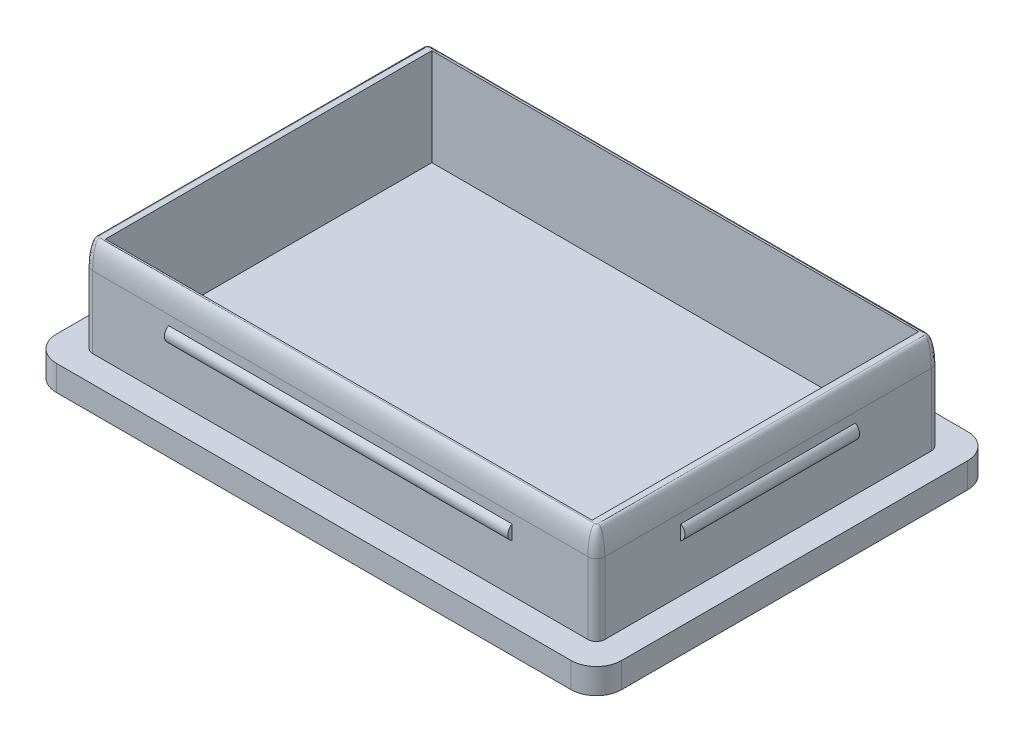
from build123d import *

# Parameters (mm, degrees)
SKETCH1_W           = 61
SKETCH1_H           = 41
BOSS_EXTRUDE1_DEPTH = 23
SHELL1_T            = 3
SKETCH2_W           = 67
SKETCH2_H           = 47
CUT_EXTRUDE1_DEPTH  = 23
SKETCH3_W           = 60.7
SKETCH3_H           = 40.7
SKETCH3_W_2         = 57.7
SKETCH3_H_2         = 38.7
BOSS_EXTRUDE2_DEPTH = 11.5
BOSS_EXTRUDE3_START = -10
SKETCH4_R           = 1
BOSS_EXTRUDE3_DEPTH = 20.7
BOSS_EXTRUDE4_START = -10
BOSS_EXTRUDE4_DEPTH = 40.7
FILLET1_R           = 3
FILLET2_R           = 1
FILLET3_SIZE        = 3
FILLET3_SIZE_2      = 0.8


with BuildPart() as part:
    # Sketch1 → Boss-Extrude1 (new body)
    with BuildSketch(Plane(origin=(0, 0, 0), x_dir=(1, 0, 0), z_dir=(0, 1, 0))):
        Rectangle(SKETCH1_W, SKETCH1_H)
    extrude(amount=BOSS_EXTRUDE1_DEPTH)

    # Shell1
    shell1_openings = [part.faces().sort_by_distance(p)[0] for p in [
        (0, 23, 0),
    ]]
    offset(amount=SHELL1_T, openings=shell1_openings, kind=Kind.INTERSECTION)

    # Sketch2 → Cut-Extrude1 (cut)
    with BuildSketch(Plane(origin=(0, 23, 0), x_dir=(1, 0, 0), z_dir=(0, 1, 0))):
        Rectangle(SKETCH2_W, SKETCH2_H)
    extrude(amount=-CUT_EXTRUDE1_DEPTH, mode=Mode.SUBTRACT)

    # Sketch3 → Boss-Extrude2 (add)
    with BuildSketch(Plane(origin=(0, 0, 0), x_dir=(1, 0, 0), z_dir=(0, 1, 0))):
        Rectangle(SKETCH3_W, SKETCH3_H)
        Rectangle(SKETCH3_W_2, SKETCH3_H_2, mode=Mode.SUBTRACT)
    extrude(amount=BOSS_EXTRUDE2_DEPTH)

    # Sketch4 → Boss-Extrude3 (add)
    with BuildSketch(Plane.XY.offset(20.35).offset(BOSS_EXTRUDE3_START)):
        with Locations((-29.85, 6.5)):
            Circle(SKETCH4_R)
        with Locations((29.85, 6.5)):
            Circle(SKETCH4_R)
    extrude(amount=-BOSS_EXTRUDE3_DEPTH)

    # Sketch5 → Boss-Extrude4 (add)
    with BuildSketch(Plane(origin=(30.35, 0, 0), x_dir=(0, 0, -1), z_dir=(1, 0, 0)).offset(BOSS_EXTRUDE4_START)):
        with BuildLine():
            Line((-20.35, 5.633974596), (-20.35, 7.366025404))
            ThreePointArc((-20.35, 7.366025404), (-20.85, 6.5), (-20.35, 5.633974596))
        make_face()
        with BuildLine():
            ThreePointArc((20.35, 5.633974596), (20.716025404, 6), (20.85, 6.5))
            ThreePointArc((20.85, 6.5), (20.716025404, 7), (20.35, 7.366025404))
            Line((20.35, 7.366025404), (20.35, 5.633974596))
        make_face()
    extrude(amount=-BOSS_EXTRUDE4_DEPTH)

    # Fillet1
    fillet1_edges = [part.edges().sort_by_distance(p)[0] for p in [
        (33.5, -1.5, 23.5),
        (-33.5, -1.5, 23.5),
        (-33.5, -1.5, -23.5),
        (33.5, -1.5, -23.5),
    ]]
    fillet(fillet1_edges, radius=FILLET1_R)

    # Fillet2
    fillet2_edges = [part.edges().sort_by_distance(p)[0] for p in [
        (30.35, 5.75, 20.35),
        (30.35, 5.75, -20.35),
        (-30.35, 5.75, -20.35),
        (-30.35, 5.75, 20.35),
    ]]
    fillet(fillet2_edges, radius=FILLET2_R)

    # Fillet3
    # an asymmetric fillet: 3, 0.8 mm, written as the material it takes off along each edge
    with BuildSketch(Plane(origin=(30.35, 11.5, -19.35), x_dir=(0, -1, 0), z_dir=(0, 0, 1)), Plane(origin=(-30.35, 11.5, 19.35), x_dir=(0, -1, 0), z_dir=(0, 0, -1))) as fillet3_piece_1:
        with BuildLine():
            Bezier((FILLET3_SIZE, 0), (0, 0), (0, -FILLET3_SIZE_2), weights=[1, 0.707106781, 1])
            Line((0, -FILLET3_SIZE_2), (0, 0))
            Line((0, 0), (FILLET3_SIZE, 0))
        make_face()
    extrude(amount=38.7, mode=Mode.SUBTRACT)
    with BuildSketch(Plane(origin=(29.35, 11.5, -19.35), x_dir=(0, 0, -1), z_dir=(-1, 0, 0))) as fillet3_piece_2:
        with BuildLine():
            Bezier((1, FILLET3_SIZE), (1, 0), (1 - FILLET3_SIZE_2, 0), weights=[1, 0.707106781, 1])
            Line((1 - FILLET3_SIZE_2, 0), (1, 0))
            Line((1, 0), (1, FILLET3_SIZE))
        make_face()
    revolve(axis=Axis((29.35, 11.5, -19.35), (0, -1, 0)), revolution_arc=90, mode=Mode.SUBTRACT)
    with BuildSketch(Plane(origin=(29.35, 11.5, 19.35), x_dir=(1, 0, 0), z_dir=(0, 0, -1))) as fillet3_piece_3:
        with BuildLine():
            Bezier((1, FILLET3_SIZE), (1, 0), (1 - FILLET3_SIZE_2, 0), weights=[1, 0.707106781, 1])
            Line((1 - FILLET3_SIZE_2, 0), (1, 0))
            Line((1, 0), (1, FILLET3_SIZE))
        make_face()
    revolve(axis=Axis((29.35, 11.5, 19.35), (0, -1, 0)), revolution_arc=90, mode=Mode.SUBTRACT)
    with BuildSketch(Plane(origin=(-29.35, 11.5, -20.35), x_dir=(0, -1, 0), z_dir=(1, 0, 0)), Plane(origin=(29.35, 11.5, 20.35), x_dir=(0, -1, 0), z_dir=(-1, 0, 0))) as fillet3_piece_4:
        with BuildLine():
            Bezier((FILLET3_SIZE, 0), (0, 0), (0, -FILLET3_SIZE_2), weights=[1, 0.707106781, 1])
            Line((0, -FILLET3_SIZE_2), (0, 0))
            Line((0, 0), (FILLET3_SIZE, 0))
        make_face()
    extrude(amount=58.7, mode=Mode.SUBTRACT)
    with BuildSketch(Plane(origin=(-29.35, 11.5, -19.35), x_dir=(0, 0, -1), z_dir=(1, 0, 0))) as fillet3_piece_5:
        with BuildLine():
            Bezier((1, -FILLET3_SIZE), (1, 0), (1 - FILLET3_SIZE_2, 0), weights=[1, 0.707106781, 1])
            Line((1 - FILLET3_SIZE_2, 0), (1, 0))
            Line((1, 0), (1, -FILLET3_SIZE))
        make_face()
    revolve(axis=Axis((-29.35, 11.5, -19.35), (0, 1, 0)), revolution_arc=90, mode=Mode.SUBTRACT)
    with BuildSketch(Plane(origin=(-29.35, 11.5, 19.35), x_dir=(0, 0, 1), z_dir=(1, 0, 0))) as fillet3_piece_6:
        with BuildLine():
            Bezier((1, FILLET3_SIZE), (1, 0), (1 - FILLET3_SIZE_2, 0), weights=[1, 0.707106781, 1])
            Line((1 - FILLET3_SIZE_2, 0), (1, 0))
            Line((1, 0), (1, FILLET3_SIZE))
        make_face()
    revolve(axis=Axis((-29.35, 11.5, 19.35), (0, -1, 0)), revolution_arc=90, mode=Mode.SUBTRACT)


solid = part.part
